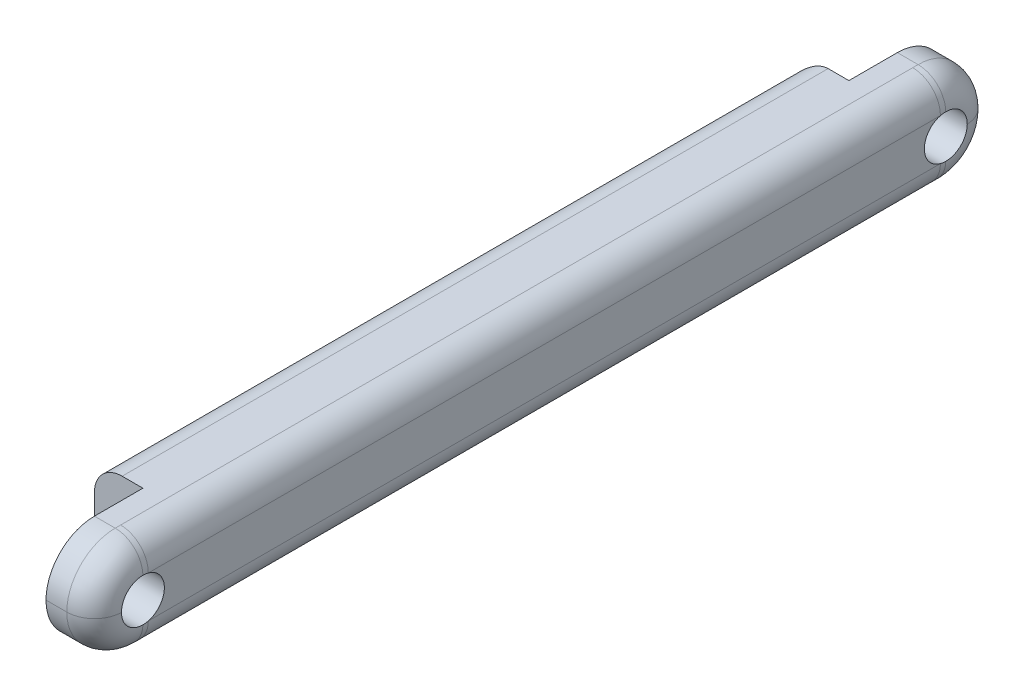
from build123d import *

# Parameters (mm, degrees)
SKETCH_1_W          = 7
SKETCH_1_H          = 7
EXTRUDE_1_DEPTH     = 51
SKETCH_2_W          = 3.5
SKETCH_2_H          = 7
EXTRUDE_2_DEPTH     = 7
SKETCH_3_W          = 3.5
SKETCH_3_H          = 7
EXTRUDE_3_DEPTH     = 7
FILLET_1_R          = 3.5
SKETCH_4_R          = 1.55
CUT_EXTRUDE_1_DEPTH = 3.5
CUT_EXTRUDE_2_DEPTH = 3.5
FILLET_2_R          = 2


with BuildPart() as part:
    # 草图1 → 凸台-拉伸1 (new body)
    with BuildSketch(Plane.XY):
        Rectangle(SKETCH_1_W, SKETCH_1_H)
    extrude(amount=EXTRUDE_1_DEPTH)

    # 草图2 → 凸台-拉伸2 (add)
    with BuildSketch(Plane.XY.offset(51)):
        with Locations((1.75, 0)):
            Rectangle(SKETCH_2_W, SKETCH_2_H)
    extrude(amount=EXTRUDE_2_DEPTH)

    # 草图3 → 凸台-拉伸3 (add)
    with BuildSketch(Plane(origin=(0, 0, 0), x_dir=(-1, 0, 0), z_dir=(0, 0, -1))):
        with Locations((-1.75, 0)):
            Rectangle(SKETCH_3_W, SKETCH_3_H)
    extrude(amount=EXTRUDE_3_DEPTH)

    # 圆角1
    fillet_1_edges = [part.edges().sort_by_distance(p)[0] for p in [
        (1.75, -3.5, 58),
        (1.75, 3.5, 58),
        (1.75, 3.5, -7),
        (1.75, -3.5, -7),
    ]]
    fillet(fillet_1_edges, radius=FILLET_1_R - 0.0001)  # a hair under: the kernel refuses the full size

    # 草图4 → 切除-拉伸1 (cut)
    with BuildSketch(Plane.ZY):
        with Locations((54.5, 0)):
            Circle(SKETCH_4_R)
        with Locations((-3.5, 0)):
            Circle(SKETCH_4_R)
    extrude(amount=-CUT_EXTRUDE_1_DEPTH, mode=Mode.SUBTRACT)

    # 草图5 → 切除-拉伸2 (cut)
    with BuildSketch(Plane.ZY.offset(3.5)):
        Polygon((0, 3.5), (7, -3.5), (0, -3.5), align=None)
    extrude(amount=-CUT_EXTRUDE_2_DEPTH, mode=Mode.SUBTRACT)

    # 圆角2
    fillet_2_edges = [part.edges().sort_by_distance(p)[0] for p in [
        (3.5, -3.5, 25.5),
        (-3.5, -3.5, 29),
        (3.5, 3.5, 25.5),
        (-3.5, 3.5, 25.5),
    ]]
    fillet(fillet_2_edges, radius=FILLET_2_R)


solid = part.part
